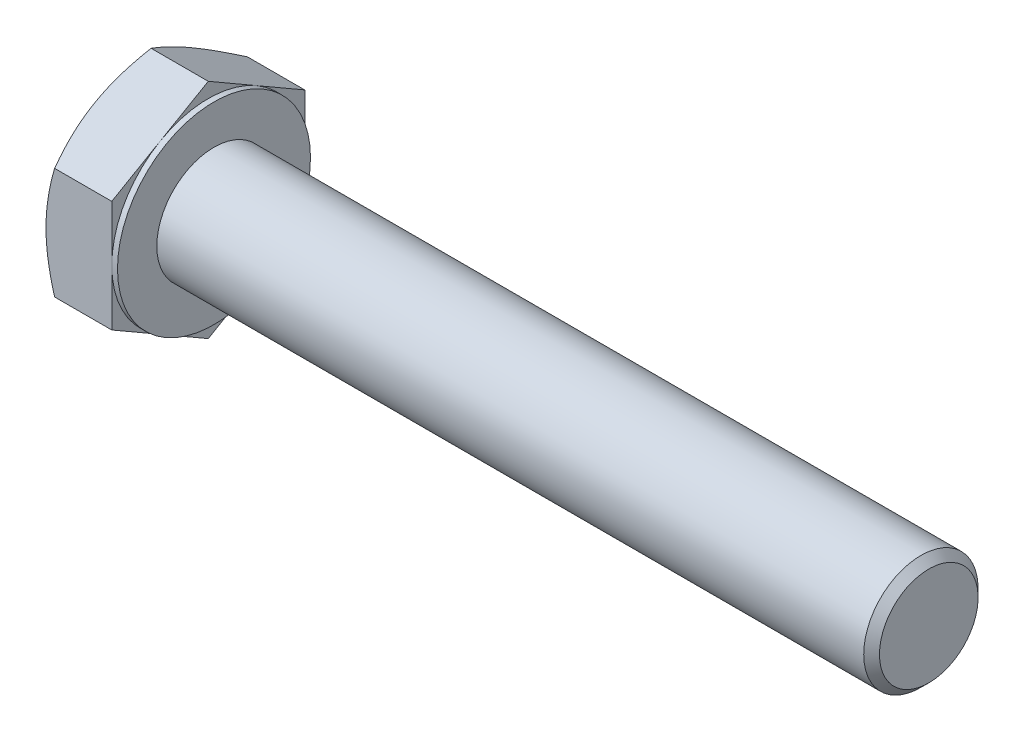
from build123d import *

# Parameters (mm, degrees)
BASEHEAD_DEPTH = 10
SKETCH4_W      = 0.8
SKETCH4_H      = 12.088457268


# Read off the part's stored shape, not the designer's step: HeadChamfer
with BuildPart() as part:
    # Sketch1 → BaseHead (new body)
    with BuildSketch(Plane(origin=(0, 0, 0), x_dir=(0, 0, -1), z_dir=(1, 0, 0))):
        Polygon((13.5, 7.794228634), (13.5, -7.794228634), (0, -15.588457268), (-13.5, -7.794228634), (-13.5, 7.794228634), (0, 15.588457268), align=None)
    extrude(amount=BASEHEAD_DEPTH)

    # HeadChamfer outline → HeadChamfer (revolve, cut)
    with BuildSketch(Plane.YX):
        Polygon((15.58845727, 1.205771367), (13.499999851, -8.6e-08), (15.58845727, -8.6e-08), align=None)
    revolve(axis=Axis((0, 0, 0), (1, 0, 0)), mode=Mode.SUBTRACT)

    # HeadChamfer 2 outline → HeadChamfer 2 (revolve)
    with BuildSketch(Plane.YX):
        Polygon((8, 10), (8, 108.8985), (6.8985, 110), (0, 110), (0, 10), align=None)
    revolve(axis=Axis((0, 0, 0), (1, 0, 0)))

    # Sketch4 → BearingFace (revolve, cut)
    with BuildSketch(Plane.XY, mode=Mode.PRIVATE) as bearingface_sk:
        with Locations((9.6, 19.544228634)):
            Rectangle(SKETCH4_W, SKETCH4_H)
    revolve(bearingface_sk.sketch.rotate(Axis((0, 0, 0), (1, 0, 0)), 90), axis=Axis((0, 0, 0), (1, 0, 0)), mode=Mode.SUBTRACT)


solid = part.part
